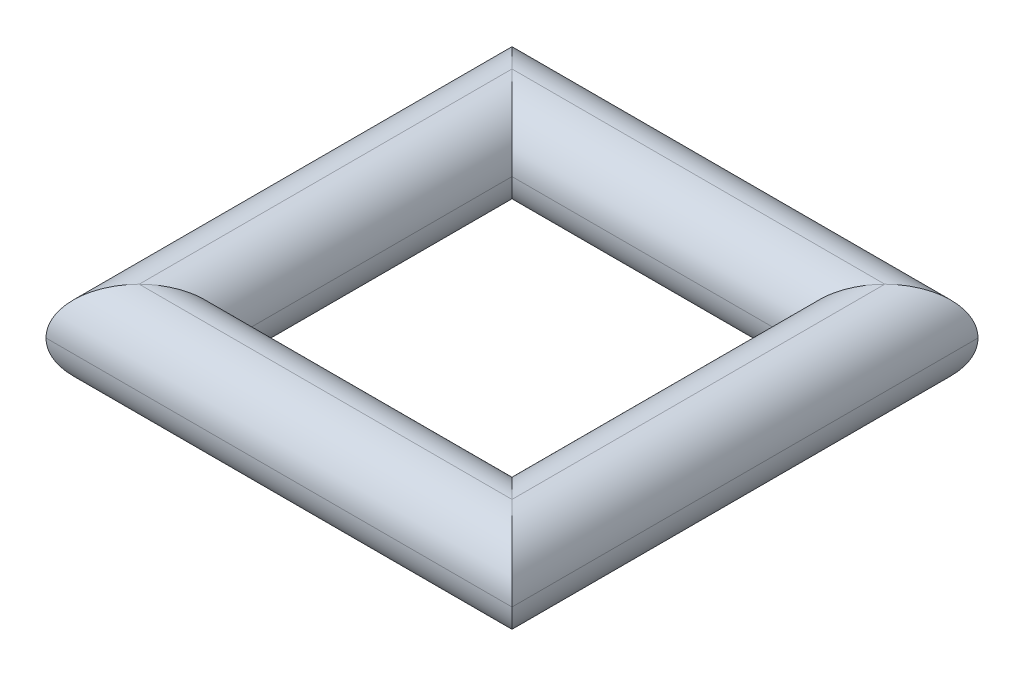
from build123d import *

# Parameters (mm, degrees)
SKETCH1_W           = 25
SKETCH1_H           = 25
BOSS_EXTRUDE1_DEPTH = 5
SKETCH2_W           = 15
SKETCH2_H           = 15
CUT_EXTRUDE1_DEPTH  = 5
FILLET1_R           = 2.5
FILLET2_R           = 2.5


with BuildPart() as part:
    # Sketch1 → Boss-Extrude1 (new body)
    with BuildSketch(Plane(origin=(0, 0, 0), x_dir=(1, 0, 0), z_dir=(0, 1, 0))):
        with Locations((-20.518867925, 12.971698113)):
            Rectangle(SKETCH1_W, SKETCH1_H)
    extrude(amount=BOSS_EXTRUDE1_DEPTH)

    # Sketch2 → Cut-Extrude1 (cut)
    with BuildSketch(Plane(origin=(0, 5, 0), x_dir=(1, 0, 0), z_dir=(0, 1, 0))):
        with Locations((-20.518867925, 12.971698113)):
            Rectangle(SKETCH2_W, SKETCH2_H)
    extrude(amount=-CUT_EXTRUDE1_DEPTH, mode=Mode.SUBTRACT)

    # Fillet1
    fillet1_edges = [part.edges().sort_by_distance(p)[0] for p in [
        (-20.518867925, 5, -0.471698113),
        (-33.018867925, 5, -12.971698113),
        (-28.018867925, 5, -12.971698113),
        (-20.518867925, 5, -5.471698113),
        (-13.018867925, 5, -12.971698113),
        (-20.518867925, 5, -20.471698113),
        (-20.518867925, 5, -25.471698113),
        (-8.018867925, 5, -12.971698113),
    ]]
    fillet(fillet1_edges, radius=FILLET1_R - 0.0001)  # a hair under: the kernel refuses the full size

    # Fillet2
    fillet2_edges = [part.edges().sort_by_distance(p)[0] for p in [
        (-33.018867925, 0, -12.971698113),
        (-20.518867925, 0, -0.471698113),
        (-8.018867925, 0, -12.971698113),
        (-20.518867925, 0, -25.471698113),
        (-20.518867925, 0, -20.471698113),
        (-13.018867925, 0, -12.971698113),
        (-20.518867925, 0, -5.471698113),
        (-28.018867925, 0, -12.971698113),
    ]]
    fillet(fillet2_edges, radius=FILLET2_R - 0.0001)  # a hair under: the kernel refuses the full size


solid = part.part
